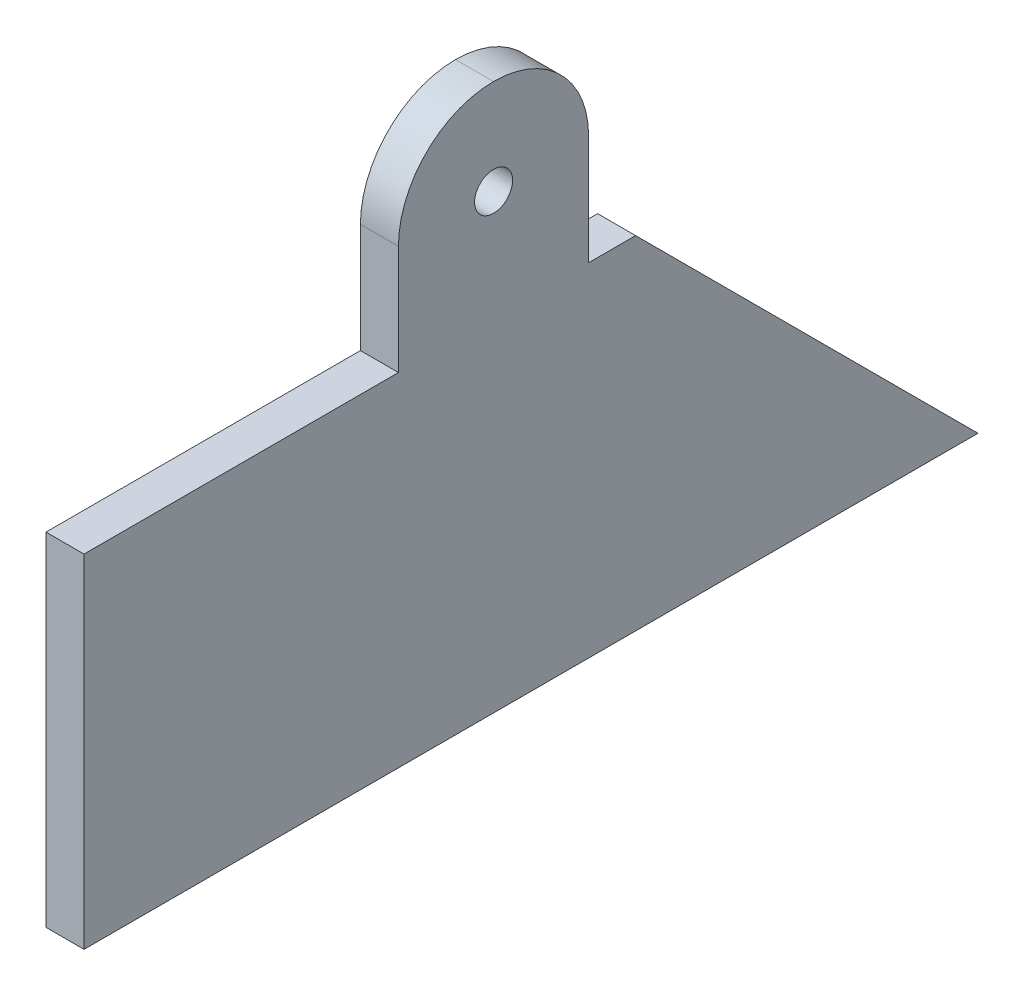
from build123d import *

# Parameters (mm, degrees)
MAIN_DEPTH  = 12.7
SKETCH2_W   = 12.7
SKETCH2_H   = 63.5
STAND_DEPTH = 68.2625
SKETCH3_R   = 6.35
AXLE_DEPTH  = 12.7
FILLET1_R   = 31.75
FILLET2_R   = 31.75


with BuildPart() as part:
    # Sketch1 → main (new body)
    with BuildSketch(Plane(origin=(0, 0, 0), x_dir=(0, 0, -1), z_dir=(1, 0, 0))):
        Polygon((0, 0), (298.45, 0), (184.15, 114.3), (0, 114.3), align=None)
    extrude(amount=MAIN_DEPTH)

    # Sketch2 → stand (add)
    with BuildSketch(Plane(origin=(0, 114.3, 0), x_dir=(1, 0, 0), z_dir=(0, 1, 0))):
        with Locations((6.35, 136.71804)):
            Rectangle(SKETCH2_W, SKETCH2_H)
    extrude(amount=STAND_DEPTH)

    # Sketch3 → axle (cut)
    with BuildSketch(Plane(origin=(12.7, 0, 0), x_dir=(0, 0, -1), z_dir=(1, 0, 0))):
        with Locations((136.71804, 150.8125)):
            Circle(SKETCH3_R)
    extrude(amount=-AXLE_DEPTH, mode=Mode.SUBTRACT)

    # Fillet1
    fillet1_edges = [part.edges().sort_by_distance(p)[0] for p in [
        (6.35, 182.5625, -168.46804),
    ]]
    fillet(fillet1_edges, radius=FILLET1_R)

    # Fillet2
    fillet2_edges = [part.edges().sort_by_distance(p)[0] for p in [
        (6.35, 182.5625, -104.96804),
    ]]
    fillet(fillet2_edges, radius=FILLET2_R - 0.0001)  # a hair under: the kernel refuses the full size


solid = part.part
